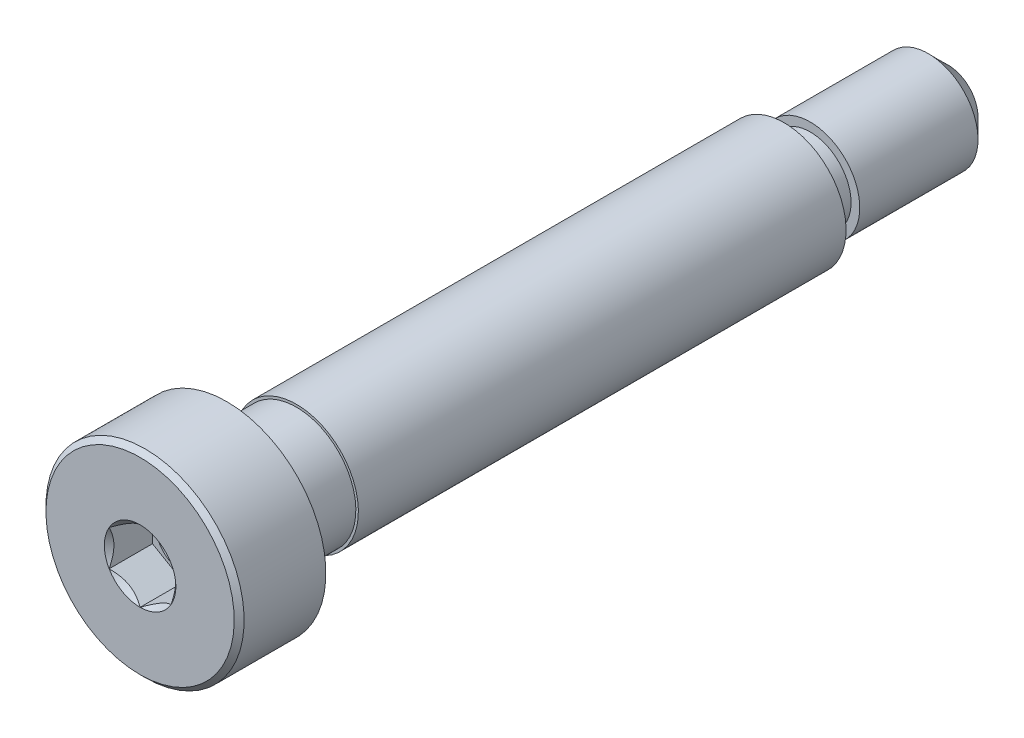
from build123d import *

# Parameters (mm, degrees)
CUT_EXTRUDE1_START = 32.6165
CUT_EXTRUDE1_DEPTH = 3.5
CHAMFER2_SIZE      = 1.578938402
SKETCH16_R         = 2.25
CUT_EXTRUDE3_DEPTH = 40


# Read off the part's stored shape, not the designer's step: Cut-Revolve-Thin1
with BuildPart() as part:
    # Sketch3 → Revolve1 (revolve)
    with BuildSketch(Plane(origin=(0, 0, 0), x_dir=(0, 0, -1), z_dir=(1, 0, 0)), mode=Mode.PRIVATE) as revolve1_sk:
        with BuildLine():
            Line((-32.6165, 0), (-32.6165, 7.48))
            Line((-32.6165, 7.48), (-32.6165, 8))
            Line((-32.6165, 8), (-26.1365, 8))
            Line((-26.1365, 8), (-25.6165, 8))
            Line((-25.6165, 8), (-25.6165, 4.797))
            Line((-25.6165, 4.797), (-19.9915, 4.797))
            Line((-19.9915, 4.797), (-19.9915, 5))
            Line((-19.9915, 5), (19.3835, 5))
            Line((19.3835, 5), (19.3835, 3.650794))
            ThreePointArc((19.3835, 3.650794), (19.485780069, 3.403868069), (19.732706, 3.301588))
            Line((19.732706, 3.301588), (21.488751203, 3.301588))
            Line((21.488751203, 3.301588), (21.488751203, 4))
            Line((21.488751203, 4), (31.679, 4))
            Line((31.679, 4), (32.6165, 4))
            Line((32.6165, 4), (32.6165, 0))
            Line((32.6165, 0), (-32.6165, 0))
        make_face()
    revolve(revolve1_sk.sketch.rotate(Axis((0, 0, 32.6165), (0, 0, -1)), 180), axis=Axis((0, 0, 32.6165), (0, 0, -1)))

    # Cut-Revolve-Thin1 outline → Cut-Revolve-Thin1 (revolve, cut)
    with BuildSketch(Plane.XZ):
        Polygon((4.758907803, 19.992271034), (3.961907803, -19.382728966), (4, -19.3835), (4.797, 19.9915), align=None)
    revolve(axis=Axis((0, 0, 0), (0, 0, 1)), mode=Mode.SUBTRACT)

    # Sketch4 → Cut-Extrude1 (cut)
    with BuildSketch(Plane.XY.offset(CUT_EXTRUDE1_START)):
        Polygon((0, 2.886751346), (-2.5, 1.443375673), (-2.5, -1.443375673), (0, -2.886751346), (2.5, -1.443375673), (2.5, 1.443375673), align=None)
    extrude(amount=-CUT_EXTRUDE1_DEPTH, mode=Mode.SUBTRACT)

    # Cut-Extrude2 cone 1 section (through the dimple's axis) → Cut-Extrude2 (revolve, cut)
    with BuildSketch(Plane(origin=(0, 0, 32.6165), x_dir=(0, -1, 0), z_dir=(1, 0, 0))):
        Polygon((0, 0), (2.886751346, 0), (0, 2.886751346), align=None)
    revolve(axis=Axis((0, 0, 32.6165), (0, 0, -1)), mode=Mode.SUBTRACT)

    # Chamfer2
    chamfer2_edges = [part.edges().sort_by_distance(p)[0] for p in [
        (0, 4, -32.6165),
    ]]
    chamfer(chamfer2_edges, length=CHAMFER2_SIZE)

    # Sketch10 → Cut-Revolve2 (revolve, cut)
    with BuildSketch(Plane(origin=(0, 0, 0), x_dir=(0, 0, -1), z_dir=(1, 0, 0)), mode=Mode.PRIVATE) as cut_revolve2_sk:
        Polygon((-32.6165, 7.6), (-32.2165, 8), (-32.6165, 8), align=None)
    revolve(cut_revolve2_sk.sketch.rotate(Axis((0, 0, 32.6165), (0, 0, -1)), 180), axis=Axis((0, 0, 32.6165), (0, 0, -1)), mode=Mode.SUBTRACT)

    # Sketch16 → Cut-Extrude3 (cut)
    with BuildSketch(Plane.XY.offset(29.1165)):
        Circle(SKETCH16_R)
    extrude(amount=-CUT_EXTRUDE3_DEPTH, mode=Mode.SUBTRACT)


solid = part.part
